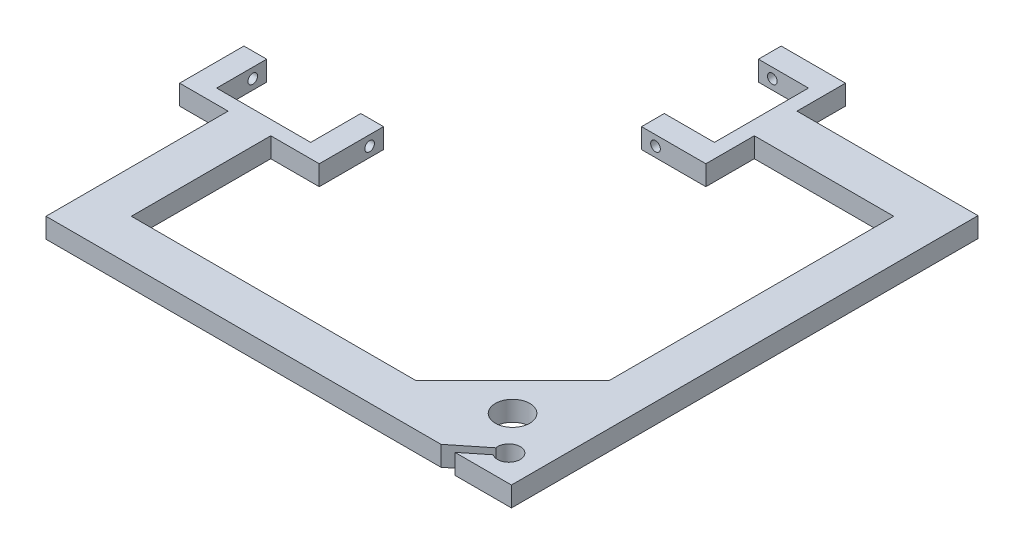
from build123d import *

# Parameters (mm, degrees)
SKETCH1_R           = 6.05
BOSS_EXTRUDE1_DEPTH = 7
SKETCH2_R           = 1.7
CUT_EXTRUDE1_DEPTH  = 60
SKETCH3_R           = 1.7
CUT_EXTRUDE2_DEPTH  = 60


with BuildPart() as part:
    # Sketch1 → Boss-Extrude1 (new body)
    with BuildSketch(Plane(origin=(0, 0, 0), x_dir=(1, 0, 0), z_dir=(0, 1, 0))):
        with BuildLine():
            Line((-86.41, -26.165178012), (-86.41, -43.765178012))
            Line((-86.41, -43.765178012), (-53.34, -43.765178012))
            Line((-53.34, -43.765178012), (-53.34, -26.165178012))
            Line((-53.34, -26.165178012), (-45.34, -26.165178012))
            Line((-45.34, -26.165178012), (-45.34, -48.765178012))
            Line((-45.34, -48.765178012), (-62.375, -48.765178012))
            Line((-62.375, -48.765178012), (-62.375, -97.765178012))
            Line((-62.375, -97.765178012), (37.625, -97.765178012))
            Line((37.625, -97.765178012), (71.6, -63.790178012))
            Line((71.6, -63.790178012), (71.6, 36.209821988))
            Line((71.6, 36.209821988), (22.6, 36.209821988))
            Line((22.6, 36.209821988), (22.6, 19.174821988))
            Line((22.6, 19.174821988), (0, 19.174821988))
            Line((0, 19.174821988), (0, 27.174821988))
            Line((0, 27.174821988), (17.6, 27.174821988))
            Line((17.6, 27.174821988), (17.6, 60.244821988))
            Line((17.6, 60.244821988), (0, 60.244821988))
            Line((0, 60.244821988), (0, 68.244821988))
            Line((0, 68.244821988), (22.6, 68.244821988))
            Line((22.6, 68.244821988), (22.6, 51.209821988))
            Line((22.6, 51.209821988), (86.215, 51.209821988))
            Line((86.215, 51.209821988), (86.215, -64.175178012))
            Line((86.215, -64.175178012), (86.215, -112.765178012))
            Line((86.215, -112.765178012), (66.349963518, -112.765178012))
            Line((66.349963518, -112.765178012), (73.821063238, -106.783510987))
            ThreePointArc((73.821063238, -106.783510987), (79.369481987, -101.331578198), (72.140531111, -104.203997211))
            Line((72.140531111, -104.203997211), (61.447619718, -112.765178012))
            Line((61.447619718, -112.765178012), (37.625, -112.765178012))
            Line((37.625, -112.765178012), (-77.375, -112.765178012))
            Line((-77.375, -112.765178012), (-77.375, -48.765178012))
            Line((-77.375, -48.765178012), (-94.41, -48.765178012))
            Line((-94.41, -48.765178012), (-94.41, -26.165178012))
            Line((-94.41, -26.165178012), (-86.41, -26.165178012))
        make_face()
        with Locations((64.6, -90.765178012)):
            Circle(SKETCH1_R, mode=Mode.SUBTRACT)
    extrude(amount=BOSS_EXTRUDE1_DEPTH)

    # Sketch2 → Cut-Extrude1 (cut)
    with BuildSketch(Plane.XY.offset(-19.174821988)):
        with Locations((4.9, 3.5)):
            Circle(SKETCH2_R)
    extrude(amount=-CUT_EXTRUDE1_DEPTH, mode=Mode.SUBTRACT)

    # Sketch3 → Cut-Extrude2 (cut)
    with BuildSketch(Plane(origin=(-45.34, 0, 0), x_dir=(0, 0, -1), z_dir=(1, 0, 0))):
        with Locations((-31.065178012, 3.5)):
            Circle(SKETCH3_R)
    extrude(amount=-CUT_EXTRUDE2_DEPTH, mode=Mode.SUBTRACT)


solid = part.part
